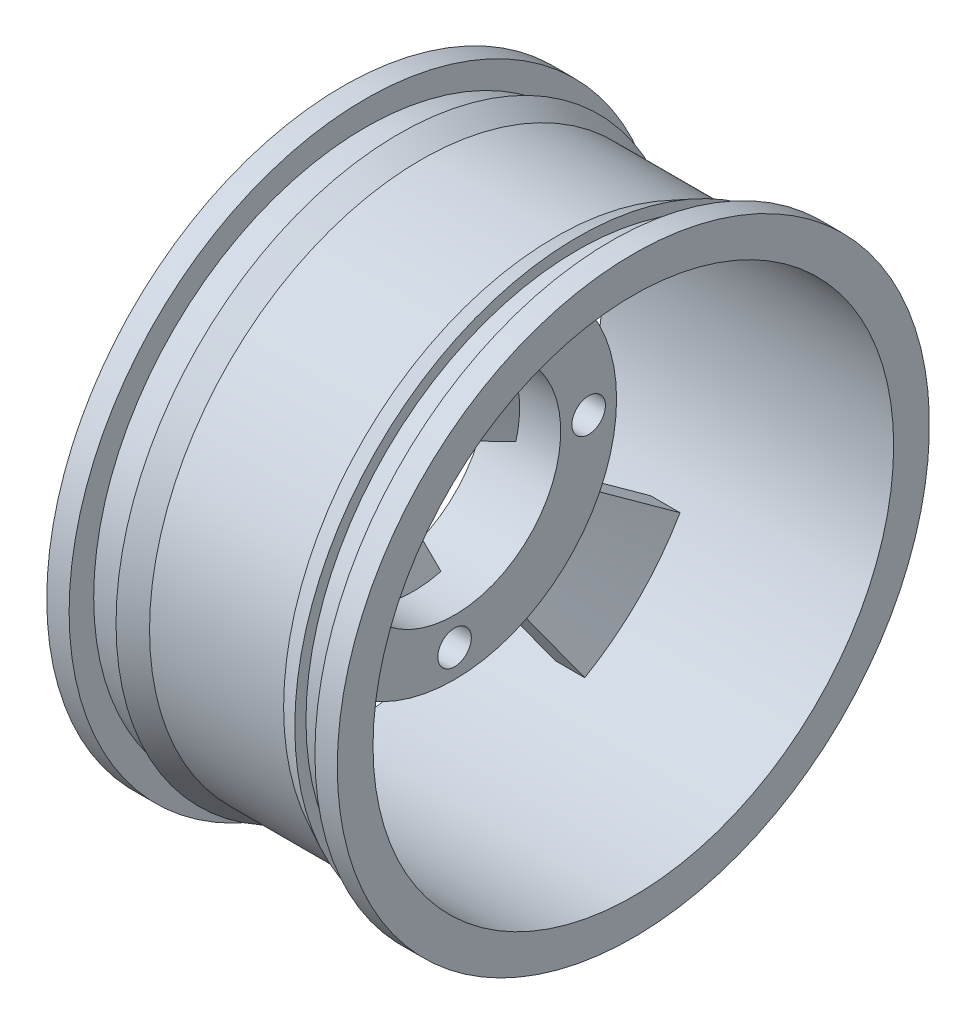
from build123d import *
from build123d.topology import SkipClean

# Parameters (mm, degrees)
REVOLVE_3_ANGLE          = 60
PATTERN_CIRCULAR_3_COUNT = 4
REVOLVE_5_ANGLE          = 30
PATTERN_CIRCULAR_2_COUNT = 4
CUT_REVOLVE_1_ANGLE      = 30
PATTERN_CIRCULAR_4_COUNT = 4
CUT_EXTRUDE_1_DEPTH      = 10
PATTERN_CIRCULAR_5_COUNT = 4


# Read off the part's stored shape, not the designer's step: 旋转5
with BuildPart() as part:
    # 草图4 → 旋转1 (revolve)
    with BuildSketch(Plane(origin=(0, 0, 0), x_dir=(1, 0, 0), z_dir=(0, 1, 0)), mode=Mode.PRIVATE) as revolve_1_sk:
        Polygon((-13, 26.5), (-11, 26.5), (-11, 24.300653513), (-8, 24.300653513), (-8, 25.300653513), (-6, 24.300653513), (6, 24.300653513), (8, 25.300653513), (8, 24.300653513), (11, 24.300653513), (11, 26.5), (13, 26.5), (13, 23.3), (-13, 23.3), align=None)
    revolve(revolve_1_sk.sketch.rotate(Axis((0, 0, 0), (1, 0, 0)), 180), axis=Axis((0, 0, 0), (1, 0, 0)))



with BuildPart() as body_2:
    # 草图4<3> → 旋转2 (revolve)
    with BuildSketch(Plane(origin=(0, 0, 0), x_dir=(1, 0, 0), z_dir=(0, 1, 0)), mode=Mode.PRIVATE) as revolve_2_sk:
        Polygon((-7.042513466, 14.5), (-9.666285329, 14.5), (-9.666285329, 9.5), (-7.042513466, 9.5), (-6.674715481, 9.5), (-3, 9.5), (-3, 12), (-3, 14.5), align=None)
    revolve(revolve_2_sk.sketch.rotate(Axis((0, 0, 0), (1, 0, 0)), 180), axis=Axis((0, 0, 0), (1, 0, 0)))


with BuildPart() as part_1:
    add(part.part)

    add(body_2.part)  # 旋转3 merges body 2
    # 草图4<4> → 旋转3 (revolve)
    with BuildSketch(Plane(origin=(0, 0, 0), x_dir=(1, 0, 0), z_dir=(0, 1, 0))):
        Polygon((-3, 23.3), (-5.623771863, 23.3), (-9.666285329, 14.5), (-7.042513466, 14.5), align=None)
    revolve_3 = revolve(axis=Axis((0, 0, 0), (1, 0, 0)), revolution_arc=REVOLVE_3_ANGLE)

    # 阵列(圆周)3: 旋转3 ×4 about axis
    pattern_circular_3_axis = Axis((-9.666285329, 0, 0), (-1, 0, 0))
    for i in range(1, PATTERN_CIRCULAR_3_COUNT):
        add(revolve_3.rotate(pattern_circular_3_axis, i * 360 / PATTERN_CIRCULAR_3_COUNT))

    # 草图4<7> → 切除-旋转1 (revolve, cut)
    with SkipClean():  # the faces are left unmerged after this step: merging them gives an invalid solid
        with BuildSketch(Plane(origin=(0, 0, 0), x_dir=(1, 0, 0), z_dir=(0, 1, 0))):
            Polygon((-3, 23.3), (-5.623771863, 23.3), (-9.666285329, 14.5), (-7.042513466, 14.5), align=None)
        cut_revolve_1 = revolve(axis=Axis((0, 0, 0), (1, 0, 0)), revolution_arc=CUT_REVOLVE_1_ANGLE, mode=Mode.SUBTRACT)

    # 阵列(圆周)4: 切除-旋转1 ×4 about axis
    with SkipClean():  # the faces are left unmerged after this step: merging them gives an invalid solid
        pattern_circular_4_axis = Axis((-9.666285329, 0, 0), (-1, 0, 0))
        for i in range(1, PATTERN_CIRCULAR_4_COUNT):
            add(cut_revolve_1.rotate(pattern_circular_4_axis, i * 360 / PATTERN_CIRCULAR_4_COUNT), mode=Mode.SUBTRACT)

    # 草图6 → 切除-拉伸1 (cut)
    with SkipClean():  # the faces are left unmerged after this step: merging them gives an invalid solid
        with BuildSketch(Plane.ZY.offset(11.741909867)):
            with BuildLine():
                ThreePointArc((-13.5, 0), (-12, -1.5), (-10.5, 0))
                Line((-10.5, 0), (-12, 0))
                Line((-12, 0), (-13.5, 0))
            make_face()
            with BuildLine():
                Line((-12, 0), (-10.5, 0))
                ThreePointArc((-10.5, 0), (-12, 1.5), (-13.5, 0))
                Line((-13.5, 0), (-12, 0))
            make_face()
        cut_extrude_1 = extrude(amount=-CUT_EXTRUDE_1_DEPTH, mode=Mode.SUBTRACT)

    # 阵列(圆周)5: 切除-拉伸1 ×4 about axis
    with SkipClean():  # the faces are left unmerged after this step: merging them gives an invalid solid
        pattern_circular_5_axis = Axis((0, 0, 0), (1, 0, 0))
        for i in range(1, PATTERN_CIRCULAR_5_COUNT):
            add(cut_extrude_1.rotate(pattern_circular_5_axis, i * 360 / PATTERN_CIRCULAR_5_COUNT), mode=Mode.SUBTRACT)


with BuildPart() as body_2_2:
    # 草图4<5> → 旋转4 (revolve)
    with BuildSketch(Plane(origin=(0, 0, 0), x_dir=(1, 0, 0), z_dir=(0, 1, 0)), mode=Mode.PRIVATE) as revolve_4_sk:
        Polygon((-8.741909867, 5), (-11.733479715, 5), (-11.741909867, 5), (-11.741909867, 3), (-8.741909867, 3), align=None)
    revolve(revolve_4_sk.sketch.rotate(Axis((0, 0, 0), (1, 0, 0)), 180), axis=Axis((0, 0, 0), (1, 0, 0)))

    # 旋转5 outline → 旋转5 (revolve)
    with BuildSketch(Plane(origin=(0, 0, 0), x_dir=(0, -0.25881904510252235, -0.9659258262890679), z_dir=(0, -0.9659258262890679, 0.25881904510252235))):
        Polygon((9.5, -6.674715481), (5, -8.741909867), (5, -11.733479715), (9.5, -9.666285329), align=None)
    revolve_5 = revolve(axis=Axis((0, 0, 0), (1, 0, 0)), revolution_arc=REVOLVE_5_ANGLE)

    # 阵列(圆周)2: 旋转5 ×4 about axis
    pattern_circular_2_axis = Axis((-11.741909867, 0, 0), (-1, 0, 0))
    for i in range(1, PATTERN_CIRCULAR_2_COUNT):
        add(revolve_5.rotate(pattern_circular_2_axis, i * 360 / PATTERN_CIRCULAR_2_COUNT))


solid = Compound([part_1.part, body_2_2.part])
